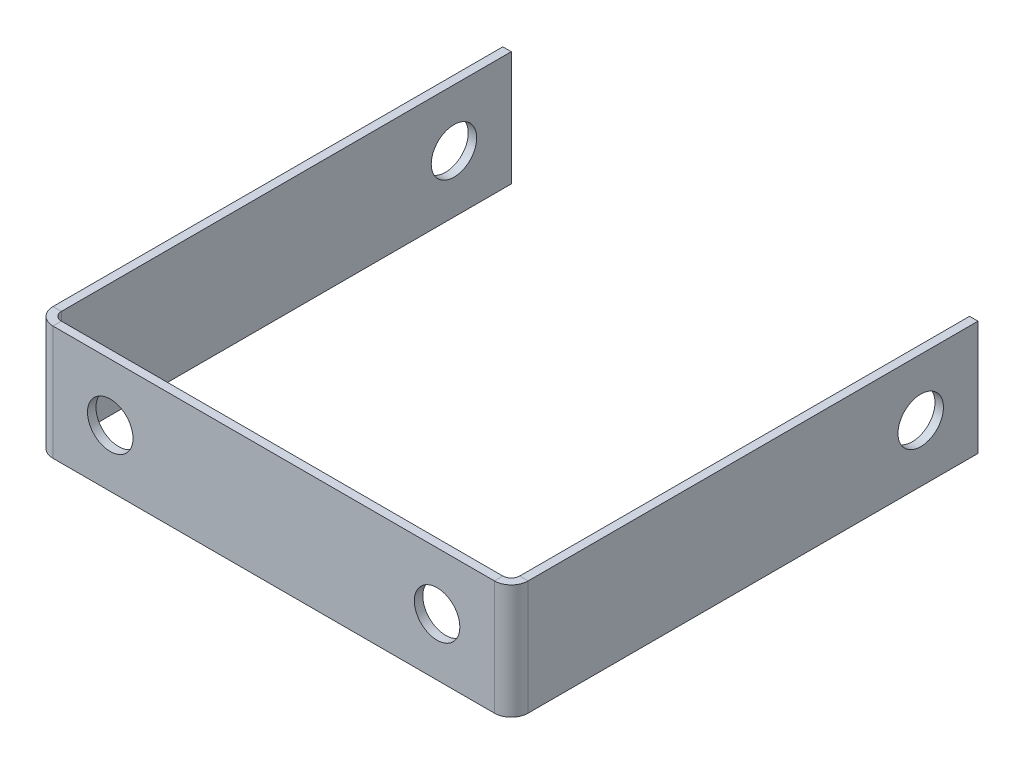
from build123d import *

# Parameters (mm, degrees)
BASE_FLANGE1_DEPTH = 10
SKETCH6_R          = 1.984375
CUT_EXTRUDE1_DEPTH = 10
SKETCH7_R          = 1.984375
CUT_EXTRUDE2_DEPTH = 59.480991085


# Sheet-metal steps are written as plain solids
with BuildPart() as part:
    # Sketch1 → Base-Flange1 (new body)
    with BuildSketch(Plane(origin=(0, 0, 0), x_dir=(1, 0, 0), z_dir=(0, 1, 0))):
        with BuildLine():
            Line((0, 40), (0, 0.7366))
            ThreePointArc((0, 0.7366), (0.215745145, 0.215745145), (0.7366, 0))
            Line((0.7366, 0), (39.2634, 0))
            ThreePointArc((39.2634, 0), (39.784254855, 0.215745145), (40, 0.7366))
            Line((40, 0.7366), (40, 40))
            Line((40, 40), (40.7366, 40))
            Line((40.7366, 40), (40.7366, 0.7366))
            ThreePointArc((40.7366, 0.7366), (40.30510971, -0.30510971), (39.2634, -0.7366))
            Line((39.2634, -0.7366), (0.7366, -0.7366))
            ThreePointArc((0.7366, -0.7366), (-0.30510971, -0.30510971), (-0.7366, 0.7366))
            Line((-0.7366, 0.7366), (-0.7366, 40))
            Line((-0.7366, 40), (0, 40))
        make_face()
    extrude(amount=BASE_FLANGE1_DEPTH)

    # Sketch6 → Cut-Extrude1 (cut)
    with BuildSketch(Plane.XY.offset(0.7366)):
        with Locations((5.7366, 5)):
            Circle(SKETCH6_R)
        with Locations((34.2634, 5)):
            Circle(SKETCH6_R)
    extrude(amount=-CUT_EXTRUDE1_DEPTH, mode=Mode.SUBTRACT)

    # Sketch7 → Cut-Extrude2 (cut, through all)
    with BuildSketch(Plane.ZY.offset(0.7366)):
        with Locations((-35, 5)):
            Circle(SKETCH7_R)
    extrude(amount=-CUT_EXTRUDE2_DEPTH, mode=Mode.SUBTRACT)


solid = part.part
